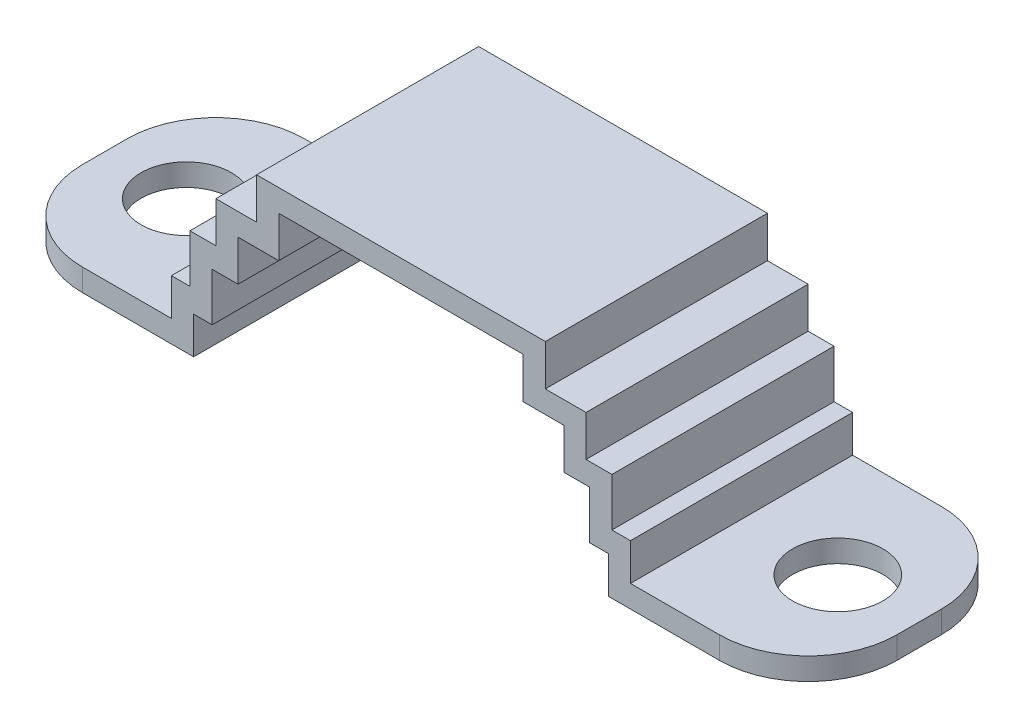
from build123d import *

# Parameters (mm, degrees)
EXTRUDE_THIN1_DEPTH  = 15
SKETCH2_R            = 6.1
CUT_EXTRUDE1_DEPTH   = 62.306626885
FILLET1_R            = 12
FILLET1_OF_MIRROR1_R = 12


with BuildPart() as part:
    # Sketch1 → Extrude-Thin1 (new, symmetric)
    with BuildSketch(Plane.XY):
        Polygon((-55, 4.5), (-28, 4.5), (-28, 9.5), (-25.5, 9.5), (-25.5, 16), (-22, 16), (-22, 21.5), (-16.5, 21.5), (-16.5, 27.05), (0, 27.05), (0, 30.05), (-19.5, 30.05), (-19.5, 24.5), (-25, 24.5), (-25, 19), (-28.5, 19), (-28.5, 12.5), (-31, 12.5), (-31, 7.5), (-55, 7.5), align=None)
    extrude_thin1 = extrude(amount=EXTRUDE_THIN1_DEPTH, both=True)

    # Sketch2 → Cut-Extrude1 (cut, through all)
    with BuildSketch(Plane(origin=(0, 7.5, 0), x_dir=(1, 0, 0), z_dir=(0, 1, 0))):
        with Locations((-44, 0)):
            Circle(SKETCH2_R)
    cut_extrude1 = extrude(amount=-CUT_EXTRUDE1_DEPTH, mode=Mode.SUBTRACT)

    # Fillet1
    fillet1_edges = [part.edges().sort_by_distance(p)[0] for p in [
        (-55, 6, -15),
        (-55, 6, 15),
    ]]
    fillet(fillet1_edges, radius=FILLET1_R)

    # Mirror1: Extrude-Thin1, Cut-Extrude1 across plane
    add(extrude_thin1.mirror(Plane(origin=(0, 30.05, 15), x_dir=(0, 0, 1), z_dir=(1, 0, 0))))
    add(cut_extrude1.mirror(Plane(origin=(0, 30.05, 15), x_dir=(0, 0, 1), z_dir=(1, 0, 0))), mode=Mode.SUBTRACT)

    # Fillet1 of Mirror1
    fillet1_of_mirror1_edges = [part.edges().sort_by_distance(p)[0] for p in [
        (55, 6, -15),
        (55, 6, 15),
    ]]
    fillet(fillet1_of_mirror1_edges, radius=FILLET1_OF_MIRROR1_R)


solid = part.part
